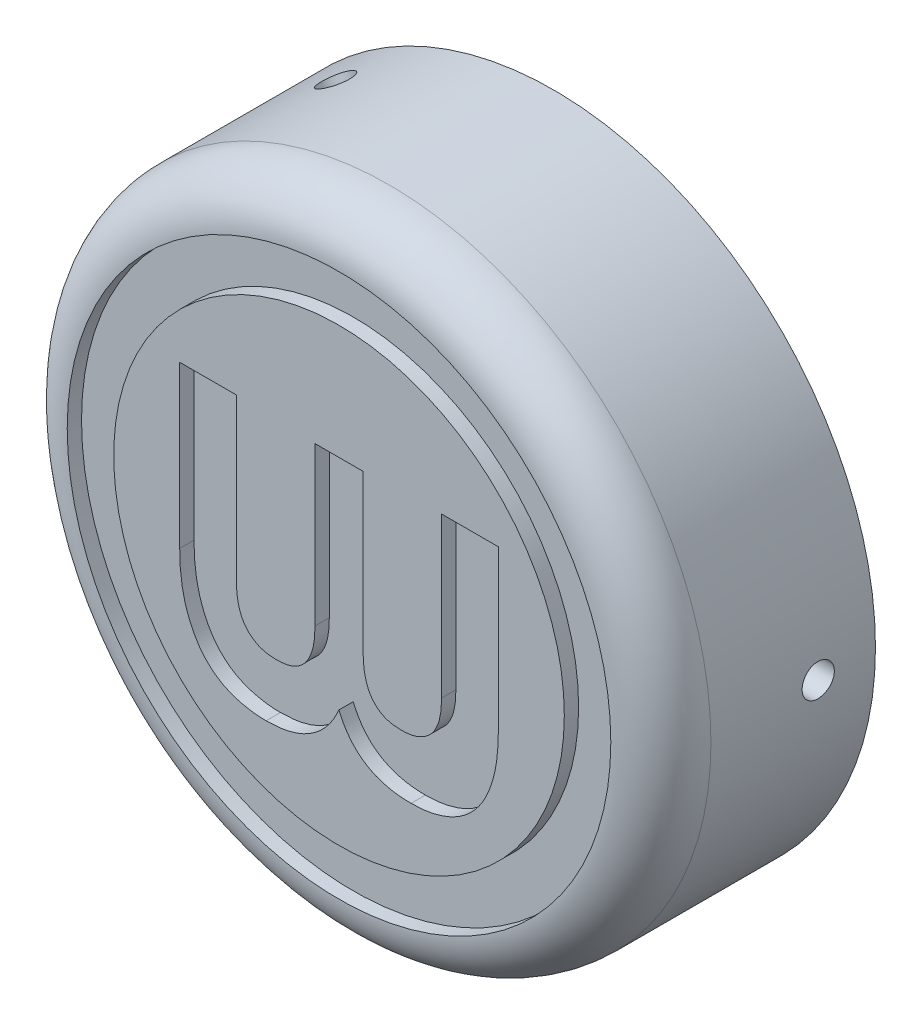
from build123d import *

# Parameters (mm, degrees)
ESQUISSE1_R                  = 45
BOSS_EXTRU_1_DEPTH           = 30
CONG_1_R                     = 7
ESQUISSE3_R                  = 40
ESQUISSE3_R_2                = 7
ESQUISSE3_R_3                = 3.15
ENL_V_MAT_EXTRU_1_DEPTH      = 15
CONG_2_R                     = 7
ESQUISSE18_R                 = 38
ESQUISSE18_R_2               = 31.5
ENL_V_MAT_EXTRU_7_DEPTH      = 2
ENL_V_MAT_EXTRU_2_DEPTH      = 2
BOSS_EXTRU_3_DEPTH           = 22
ENL_V_MAT_EXTRU_3_DEPTH      = 8
ESQUISSE14_W                 = 8
ESQUISSE14_H                 = 7.5
ENL_V_MAT_EXTRU_4_DEPTH      = 8
ESQUISSE15_W                 = 4
ESQUISSE15_H                 = 14
BOSS_EXTRU_4_DEPTH           = 15
ENL_V_START                  = -15
ESQUISSE16_R                 = 2.25
ENL_V_MAT_EXTRU_5_DEPTH      = 46
ESQUISSE17_R                 = 7
ENL_V_MAT_EXTRU_6_DEPTH      = 8
R_P_TITION_CIRCULAIRE1_COUNT = 3


with BuildPart() as part:
    # Esquisse1 → Boss.-Extru.1 (new body)
    with BuildSketch(Plane.XY):
        Circle(ESQUISSE1_R)
    extrude(amount=BOSS_EXTRU_1_DEPTH)

    # Congé1
    cong_1_edges = [part.edges().sort_by_distance(p)[0] for p in [
        (-45, 0, 30),
    ]]
    fillet(cong_1_edges, radius=CONG_1_R)

    # Esquisse3 → Enlèv. mat.-Extru.1 (cut)
    # profile 1 of 2: a face of its own
    with BuildSketch(Plane(origin=(0, 0, 0), x_dir=(-1, 0, 0), z_dir=(0, 0, -1))):
        Circle(ESQUISSE3_R)
        Circle(ESQUISSE3_R_2, mode=Mode.SUBTRACT)
    # profile 2 of 2: a face of its own
    with BuildSketch(Plane(origin=(0, 0, 0), x_dir=(-1, 0, 0), z_dir=(0, 0, -1))):
        Circle(ESQUISSE3_R_3)
    extrude(amount=-ENL_V_MAT_EXTRU_1_DEPTH, mode=Mode.SUBTRACT)

    # Congé2
    cong_2_edges = [part.edges().sort_by_distance(p)[0] for p in [
        (40, 0, 15),
    ]]
    fillet(cong_2_edges, radius=CONG_2_R)

    # Esquisse18 → Enlèv. mat.-Extru.7 (cut)
    with BuildSketch(Plane.XY.offset(30)):
        Circle(ESQUISSE18_R)
        Circle(ESQUISSE18_R_2, mode=Mode.SUBTRACT)
    extrude(amount=-ENL_V_MAT_EXTRU_7_DEPTH, mode=Mode.SUBTRACT)

    # Esquisse4 → Enlèv. mat.-Extru.2 (cut)
    with BuildSketch(Plane.XY.offset(30)):
        with BuildLine():
            Line((22.276136393, 15.815087922), (14.342574749, 15.815087922))
            Line((14.342574749, 15.815087922), (14.342574749, -6.459912078))
            add(Edge.make_bspline(
                [(14.342574749, -6.459912078), (14.335430814, -6.746026414), (14.321599809, -7.299957671), (14.262634779, -8.101213795), (14.133051944, -8.835622699), (13.977848156, -9.512237101), (13.75607675, -10.124818577), (13.490152374, -10.677032551), (13.184338218, -11.176049505), (12.70140493, -11.738830767), (12.000641068, -12.330736563), (11.012402364, -12.833660169), (9.891279438, -13.136512556), (9.100010088, -13.166728304), (8.688004971, -13.182461307)],
                knots=[0, 0, 0, 0, 1.027532295, 1.989352446, 2.880409557, 3.702375202, 4.478385883, 5.213290886, 5.90030528, 6.572374461, 7.868279017, 9.164535182, 10.523605126, 12, 12, 12, 12], degree=3))
            add(Edge.make_bspline(
                [(8.688004971, -13.182461307), (8.269373889, -13.164924361), (7.4758693, -13.131683525), (6.363455906, -12.812006716), (5.418262089, -12.268727712), (4.655487422, -11.491549528), (4.053435286, -10.51689439), (3.655059886, -9.320203038), (3.410064825, -7.925719563), (3.382065457, -6.925147039), (3.367178773, -6.393163362)],
                knots=[0, 0, 0, 0, 1.018879438, 1.931260109, 2.792639425, 3.647578955, 4.559498644, 5.562064023, 6.70379996, 8, 8, 8, 8], degree=3))
            Line((3.367178773, -6.393163362), (3.367178773, 15.490879874))
            Line((3.367178773, 15.490879874), (-3.355370457, 15.490879874))
            Line((-3.355370457, 15.490879874), (-3.355370457, -6.593409509))
            add(Edge.make_bspline(
                [(-3.355370457, -6.593409509), (-3.371121613, -7.125036209), (-3.400746911, -8.124937318), (-3.635447629, -9.52595785), (-4.068279408, -10.709034549), (-4.649795269, -11.702058071), (-5.437079767, -12.465356311), (-6.391829634, -13.015234576), (-7.522078331, -13.33116867), (-8.327690948, -13.364913963), (-8.752480902, -13.382707454)],
                knots=[0, 0, 0, 0, 1.288266081, 2.423013523, 3.424668841, 4.326971466, 5.187640582, 6.05040986, 6.972004298, 8, 8, 8, 8], degree=3))
            add(Edge.make_bspline(
                [(-8.752480902, -13.382707454), (-9.167592009, -13.363402704), (-9.965577313, -13.326292382), (-11.09448314, -13.020103069), (-12.077045437, -12.492628415), (-12.762659661, -11.880325041), (-13.218068839, -11.293118395), (-13.528042256, -10.798566438), (-13.768366246, -10.23834499), (-13.984954121, -9.632232511), (-14.142142056, -8.966631569), (-14.252805204, -8.245839407), (-14.335813837, -7.472572545), (-14.338772954, -6.936930457), (-14.340301964, -6.660158225)],
                knots=[0, 0, 0, 0, 1.498680819, 2.880976318, 4.186487607, 5.496287625, 6.167285469, 6.868667386, 7.598809326, 8.365363691, 9.192845487, 10.065348394, 11.000343967, 12, 12, 12, 12], degree=3))
            Line((-14.340301964, -6.660158225), (-14.340301964, 15.881836638))
            Line((-14.340301964, 15.881836638), (-22.273863607, 15.881836638))
            Line((-22.273863607, 15.881836638), (-22.273863607, -6.660158225))
            add(Edge.make_bspline(
                [(-22.273863607, -6.660158225), (-22.263930677, -7.296304024), (-22.244819958, -8.520233271), (-22.070155023, -10.285857039), (-21.792921451, -11.907934108), (-21.388651115, -13.390956863), (-20.885931412, -14.737925114), (-20.28752452, -15.956219784), (-19.628718317, -17.064703732), (-18.85400785, -18.033953741), (-18.009214701, -18.885469901), (-17.078810223, -19.610045848), (-16.077045435, -20.217565016), (-14.98935261, -20.676615746), (-13.853124861, -21.042293163), (-12.667179676, -21.292738529), (-11.443460459, -21.46674358), (-10.612534075, -21.480800342), (-10.192346056, -21.487908653)],
                knots=[0, 0, 0, 0, 1.404755851, 2.702716539, 3.914663576, 5.035327061, 6.09285721, 7.085052499, 8.030232485, 8.934803431, 9.818453903, 10.673731492, 11.533406423, 12.39811208, 13.275127836, 14.166083051, 15.072613476, 16, 16, 16, 16], degree=3))
            add(Edge.make_bspline(
                [(-10.192346056, -21.487908653), (-9.583943176, -21.468339569), (-8.40979774, -21.430573558), (-6.728848946, -21.126469853), (-5.204773181, -20.610840236), (-3.846099129, -19.87609482), (-2.639425069, -18.9540259), (-1.601481298, -17.83510092), (-0.698165424, -16.548786873), (-0.248342994, -15.583835475), (-0.017934669, -15.089567471)],
                knots=[0, 0, 0, 0, 1.13778138, 2.195783188, 3.183165657, 4.135762968, 5.073089588, 6.011321364, 6.981357796, 8, 8, 8, 8], degree=3))
            add(Edge.make_bspline(
                [(-0.017934669, -15.089567471), (0.208637216, -15.587197941), (0.648569915, -16.553442788), (1.543830402, -17.837406649), (2.582900186, -18.931857447), (3.780328808, -19.830582302), (5.137721906, -20.526662262), (6.65010466, -21.003254215), (8.310204795, -21.309044463), (9.468468522, -21.338892858), (10.070656941, -21.354411221)],
                knots=[0, 0, 0, 0, 1.031965863, 2.003759331, 2.943053477, 3.8744721, 4.820489052, 5.812454333, 6.862681584, 8, 8, 8, 8], degree=3))
            add(Edge.make_bspline(
                [(10.070656941, -21.354411221), (10.503207298, -21.341424604), (11.358247876, -21.315753408), (12.616289951, -21.172504345), (13.818174426, -20.882105195), (14.973016392, -20.520353359), (16.067881507, -20.033902482), (17.082263962, -19.417027376), (18.026813541, -18.691488428), (18.875174304, -17.830791341), (19.658844847, -16.864889652), (20.330682128, -15.76085109), (20.915277845, -14.536462469), (21.411150814, -13.190583428), (21.799928718, -11.708999273), (22.087671164, -10.089866595), (22.242655829, -8.32238135), (22.264703646, -7.095897164), (22.276136393, -6.459912078)],
                knots=[0, 0, 0, 0, 0.948736148, 1.875406851, 2.769696817, 3.655693005, 4.526064859, 5.389011033, 6.253306968, 7.130488151, 8.032780387, 8.97468306, 9.95657695, 11.00393301, 12.114578639, 13.310790335, 14.6055285, 16, 16, 16, 16], degree=3))
            Line((22.276136393, -6.459912078), (22.276136393, 15.815087922))
        make_face()
    extrude(amount=-ENL_V_MAT_EXTRU_2_DEPTH, mode=Mode.SUBTRACT)

    # Esquisse12 → Boss.-Extru.3 (add)
    with BuildSketch(Plane(origin=(0, 0, 0), x_dir=(-1, 0, 0), z_dir=(0, 0, -1))):
        with BuildLine():
            Line((0, 3.15), (0, 7))
            Line((0, 7), (-14, 7))
            Line((-14, 7), (-14, -7))
            Line((-14, -7), (0, -7))
            Line((0, -7), (0, -3.15))
            ThreePointArc((0, -3.15), (-3.15, 0), (0, 3.15))
        make_face()
    boss_extru_3 = extrude(amount=-BOSS_EXTRU_3_DEPTH)

    # Esquisse13 → Enlèv. mat.-Extru.3 (cut)
    with BuildSketch(Plane(origin=(14, 0, 0), x_dir=(0, 0, -1), z_dir=(1, 0, 0))):
        Polygon((-10.165063509, 3.75), (-12.330127019, 0), (-10.165063509, -3.75), (-5.834936491, -3.75), (-3.669872981, 0), (-5.834936491, 3.75), align=None)
    enl_v_mat_extru_3 = extrude(amount=-ENL_V_MAT_EXTRU_3_DEPTH, mode=Mode.SUBTRACT)

    # Esquisse14 → Enlèv. mat.-Extru.4 (cut)
    with BuildSketch(Plane(origin=(0, 0, 0), x_dir=(-1, 0, 0), z_dir=(0, 0, -1))):
        with Locations((-10, 0)):
            Rectangle(ESQUISSE14_W, ESQUISSE14_H)
    enl_v_mat_extru_4 = extrude(amount=-ENL_V_MAT_EXTRU_4_DEPTH, mode=Mode.SUBTRACT)

    # Esquisse15 → Boss.-Extru.4 (add)
    with BuildSketch(Plane(origin=(0, 0, 15), x_dir=(-1, 0, 0), z_dir=(0, 0, -1))):
        with Locations((-13.5, 0)):
            Rectangle(ESQUISSE15_W, ESQUISSE15_H)
    boss_extru_4 = extrude(amount=BOSS_EXTRU_4_DEPTH)

    # Esquisse16 → Enlèv. mat.-Extru.5 (cut)
    with BuildSketch(Plane(origin=(15.5, 0, 0), x_dir=(0, 0, -1), z_dir=(1, 0, 0)).offset(ENL_V_START)):
        with Locations((-8, 0)):
            Circle(ESQUISSE16_R)
    enl_v_mat_extru_5 = extrude(amount=ENL_V_MAT_EXTRU_5_DEPTH, mode=Mode.SUBTRACT)

    # Esquisse17 → Enlèv. mat.-Extru.6 (cut)
    with BuildSketch(Plane(origin=(15.5, 0, 0), x_dir=(0, 0, -1), z_dir=(1, 0, 0))):
        with Locations((-8.317654901, 0)):
            Circle(ESQUISSE17_R)
    enl_v_mat_extru_6 = extrude(amount=ENL_V_MAT_EXTRU_6_DEPTH, mode=Mode.SUBTRACT)

    # Répétition circulaire1: Boss.-Extru.3, Enlèv. mat.-Extru.3, Enlèv. mat.-Extru.4, Boss.-Extru.4, Enlèv. mat.-Extru.5, Enlèv. mat.-Extru.6 ×3 about axis
    r_p_tition_circulaire1_axis = Axis((0, 0, 0), (0, 0, -1))
    add([boss_extru_3.rotate(r_p_tition_circulaire1_axis, i * 360 / R_P_TITION_CIRCULAIRE1_COUNT) for i in range(1, R_P_TITION_CIRCULAIRE1_COUNT)])
    add([enl_v_mat_extru_3.rotate(r_p_tition_circulaire1_axis, i * 360 / R_P_TITION_CIRCULAIRE1_COUNT) for i in range(1, R_P_TITION_CIRCULAIRE1_COUNT)], mode=Mode.SUBTRACT)
    add([enl_v_mat_extru_4.rotate(r_p_tition_circulaire1_axis, i * 360 / R_P_TITION_CIRCULAIRE1_COUNT) for i in range(1, R_P_TITION_CIRCULAIRE1_COUNT)], mode=Mode.SUBTRACT)
    add([boss_extru_4.rotate(r_p_tition_circulaire1_axis, i * 360 / R_P_TITION_CIRCULAIRE1_COUNT) for i in range(1, R_P_TITION_CIRCULAIRE1_COUNT)])
    add([enl_v_mat_extru_5.rotate(r_p_tition_circulaire1_axis, i * 360 / R_P_TITION_CIRCULAIRE1_COUNT) for i in range(1, R_P_TITION_CIRCULAIRE1_COUNT)], mode=Mode.SUBTRACT)
    add([enl_v_mat_extru_6.rotate(r_p_tition_circulaire1_axis, i * 360 / R_P_TITION_CIRCULAIRE1_COUNT) for i in range(1, R_P_TITION_CIRCULAIRE1_COUNT)], mode=Mode.SUBTRACT)


solid = part.part
